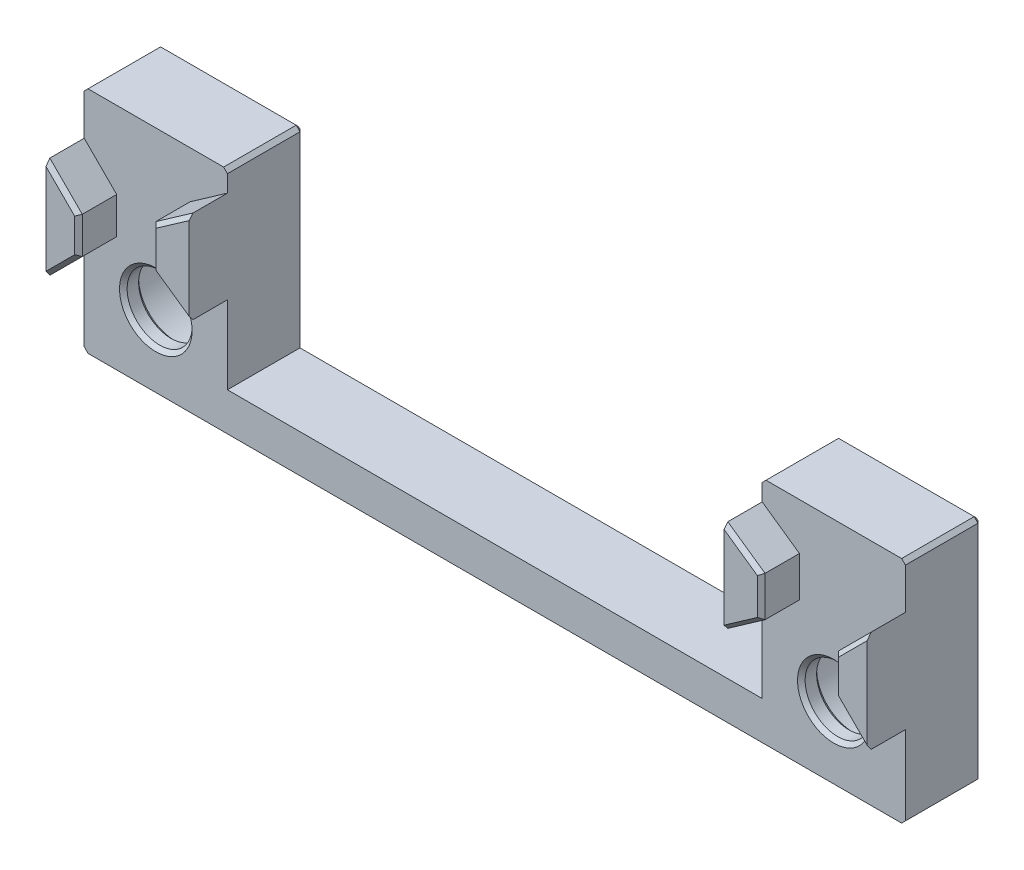
from build123d import *

# Parameters (mm, degrees)
BOSS_EXTRUDE1_DEPTH            = 4
SLOT_ALIGNER_DEPTH             = 2
ALIGNER_DEPTH                  = 2
DEBURS_SIZE                    = 0.2
CBORE_FOR_M3_SHCS1_D           = 3.4
CBORE_FOR_M3_SHCS1_CBORE_D     = 6.5
CBORE_FOR_M3_SHCS1_CBORE_DEPTH = 3
CHAMFER1_SIZE                  = 0.2


with BuildPart() as part:
    # Sketch1 → Boss-Extrude1 (new body)
    with BuildSketch(Plane.XY):
        Polygon((-21.3, -6), (21.3, -6), (21.5, -5.8), (21.5, 5.8), (21.3, 6), (14.2, 6), (14, 5.8), (14, -4), (-14, -4), (-14, 5.8), (-14.2, 6), (-21.3, 6), (-21.5, 5.8), (-21.5, -5.8), align=None)
    extrude(amount=-BOSS_EXTRUDE1_DEPTH)

    # Sketch3 → Slot Aligner (add)
    with BuildSketch(Plane.XY):
        Polygon((14, 4.917873342), (14, 0.082126658), (15.95, 1.447531358), (15.95, 3.552468642), align=None)
    slot_aligner = extrude(amount=SLOT_ALIGNER_DEPTH)

    # Mirror3: Slot Aligner across plane
    add(slot_aligner.mirror(Plane(origin=(0, 0, 0), x_dir=(0, 0, 1), z_dir=(1, 0, 0))))

    # Sketch4 → Aligner (add)
    with BuildSketch(Plane(origin=(0, 0, 0), x_dir=(-1, 0, 0), z_dir=(0, 0, -1))):
        Polygon((-19.8, 1.958578644), (-21.4, 3.558578644), (-21.5, 3.658578644), (-21.5, -1.658578644), (-21.4, -1.558578644), (-19.8, 0.041421356), align=None)
    aligner = extrude(amount=-ALIGNER_DEPTH)

    # Aligners: Aligner across plane
    add(aligner.mirror(Plane(origin=(0, 0, 0), x_dir=(0, 0, 1), z_dir=(1, 0, 0))))

    # Deburs
    deburs_edges = [part.edges().sort_by_distance(p)[0] for p in [
        (14, 0.9, -4),
        (14.1, 5.9, -4),
        (17.75, 6, -4),
        (21.4, 5.9, -4),
        (21.5, 0, -4),
        (21.4, -5.9, -4),
        (0, -6, -4),
        (-21.4, -5.9, -4),
        (-21.5, 0, -4),
        (-21.4, 5.9, -4),
        (-17.75, 6, -4),
        (-14.1, 5.9, -4),
        (-14, 0.9, -4),
        (0, -4, -4),
        (20.65, -0.808578644, 2),
        (20.65, 2.808578644, 2),
        (19.8, 1, 2),
        (14.975, 4.235170992, 2),
        (15.95, 2.5, 2),
        (14.975, 0.764829008, 2),
        (-14.975, 4.235170992, 2),
        (-15.95, 2.5, 2),
        (-14.975, 0.764829008, 2),
        (-20.65, 2.808578644, 2),
        (-19.8, 1, 2),
        (-20.65, -0.808578644, 2),
    ]]
    chamfer(deburs_edges, length=DEBURS_SIZE)

    # CBORE for M3 SHCS1 (through all)
    with Locations(Plane(origin=(0, 0, -4), x_dir=(-1, 0, 0), z_dir=(0, 0, -1))):
        with Locations((-17.75, -2.25), (17.75, -2.25)):
            CounterBoreHole(CBORE_FOR_M3_SHCS1_D / 2, CBORE_FOR_M3_SHCS1_CBORE_D / 2, CBORE_FOR_M3_SHCS1_CBORE_DEPTH)

    # Chamfer1
    chamfer1_edges = [part.edges().sort_by_distance(p)[0] for p in [
        (-19.45, -2.25, 0),
        (-19.45, -2.25, -1),
        (16.05, -2.25, 0),
        (16.05, -2.25, -1),
        (21, -2.25, -4),
        (-14.5, -2.25, -4),
    ]]
    chamfer(chamfer1_edges, length=CHAMFER1_SIZE)


solid = part.part
